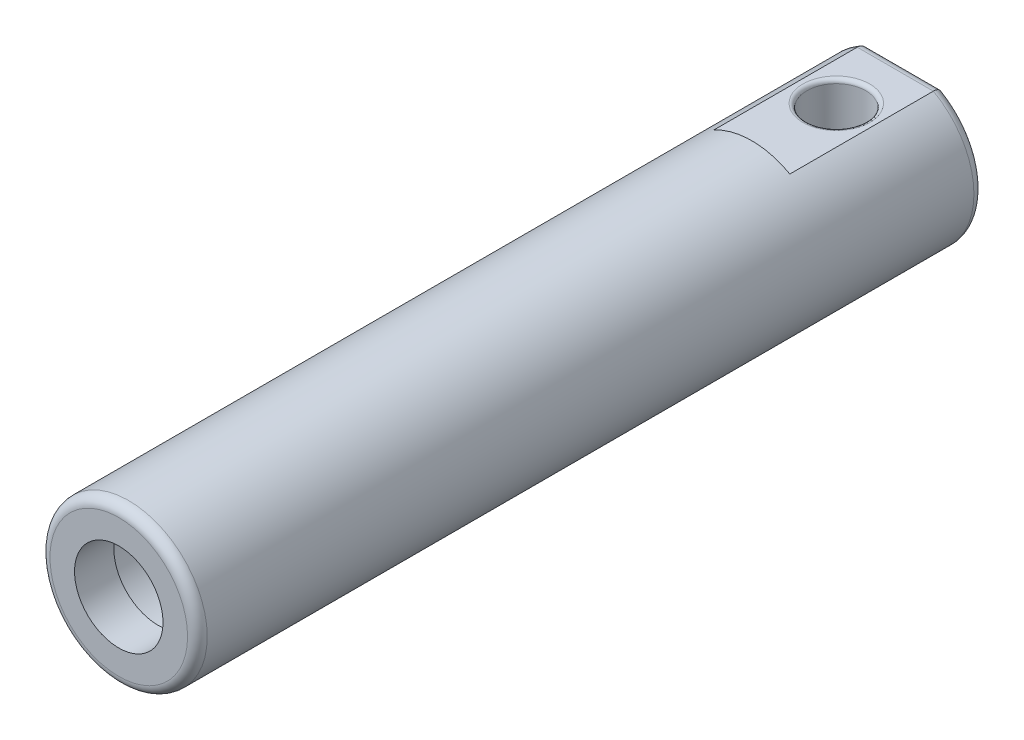
from build123d import *

# Parameters (mm, degrees)
SKETCH2_R           = 40
BOSS_EXTRUDE1_DEPTH = 320
SKETCH3_R           = 30
CUT_EXTRUDE1_DEPTH  = 300
CUT_EXTRUDE2_REACH  = 326.962
SKETCH4_R           = 22.5
BOSS_EXTRUDE2_START = 80
SKETCH5_R           = 40
BOSS_EXTRUDE2_DEPTH = 80
SKETCH6_W           = 40
SKETCH6_H           = 78
CUT_EXTRUDE3_DEPTH  = 5
SKETCH7_R           = 15
CUT_EXTRUDE4_DEPTH  = 332.096662623
FILLET2_R           = 5
FILLET3_R           = 2


with BuildPart() as part:
    # Sketch2 → Boss-Extrude1 (new body)
    with BuildSketch(Plane.XY):
        Circle(SKETCH2_R)
    extrude(amount=BOSS_EXTRUDE1_DEPTH)

    # Sketch3 → Cut-Extrude1 (cut)
    with BuildSketch(Plane(origin=(0, 0, 0), x_dir=(-1, 0, 0), z_dir=(0, 0, -1))):
        Circle(SKETCH3_R)
    extrude(amount=-CUT_EXTRUDE1_DEPTH, mode=Mode.SUBTRACT)

    # Sketch4 → Cut-Extrude2 (cut, up to next)
    with BuildSketch(Plane.XY.offset(320), mode=Mode.PRIVATE) as cut_extrude2_sk1:
        Circle(SKETCH4_R)
    cut_extrude2_tool1 = extrude(cut_extrude2_sk1.sketch, amount=-CUT_EXTRUDE2_REACH, mode=Mode.PRIVATE) & part.part
    add(cut_extrude2_tool1.solids().sort_by_distance((0, 0, 320))[0], mode=Mode.SUBTRACT)

    # Sketch5 → Boss-Extrude2 (add)
    with BuildSketch(Plane(origin=(0, 0, 0), x_dir=(-1, 0, 0), z_dir=(0, 0, -1)).offset(BOSS_EXTRUDE2_START)):
        Circle(SKETCH5_R)
    extrude(amount=-BOSS_EXTRUDE2_DEPTH)

    # Sketch6 → Cut-Extrude3 (cut)
    with BuildSketch(Plane(origin=(0, 40, 0), x_dir=(1, 0, 0), z_dir=(0, 1, 0))):
        with Locations((0, 41)):
            Rectangle(SKETCH6_W, SKETCH6_H)
    cut_extrude3 = extrude(amount=-CUT_EXTRUDE3_DEPTH, mode=Mode.SUBTRACT)

    # Mirror1: Cut-Extrude3 across plane
    add(cut_extrude3.mirror(Plane.ZX), mode=Mode.SUBTRACT)

    # Sketch7 → Cut-Extrude4 (cut, through all)
    with BuildSketch(Plane(origin=(0, 35, 0), x_dir=(1, 0, 0), z_dir=(0, 1, 0))):
        with Locations(Location((0, 45, 0), (0, 0, 270))):
            Circle(SKETCH7_R)
    extrude(amount=-CUT_EXTRUDE4_DEPTH, mode=Mode.SUBTRACT)

    # Fillet2
    fillet2_edges = [part.edges().sort_by_distance(p)[0] for p in [
        (40, 0, -80),
        (0, 35, -80),
        (-34.457195687, 20.315060063, -80),
        (0, -35, -80),
        (-40, 0, 320),
    ]]
    fillet(fillet2_edges, radius=FILLET2_R - 0.0001)  # a hair under: the kernel refuses the full size

    # Fillet3
    fillet3_edges = [part.edges().sort_by_distance(p)[0] for p in [
        (0, -35, -60),
        (0, 35, -60),
    ]]
    fillet(fillet3_edges, radius=FILLET3_R)


solid = part.part
